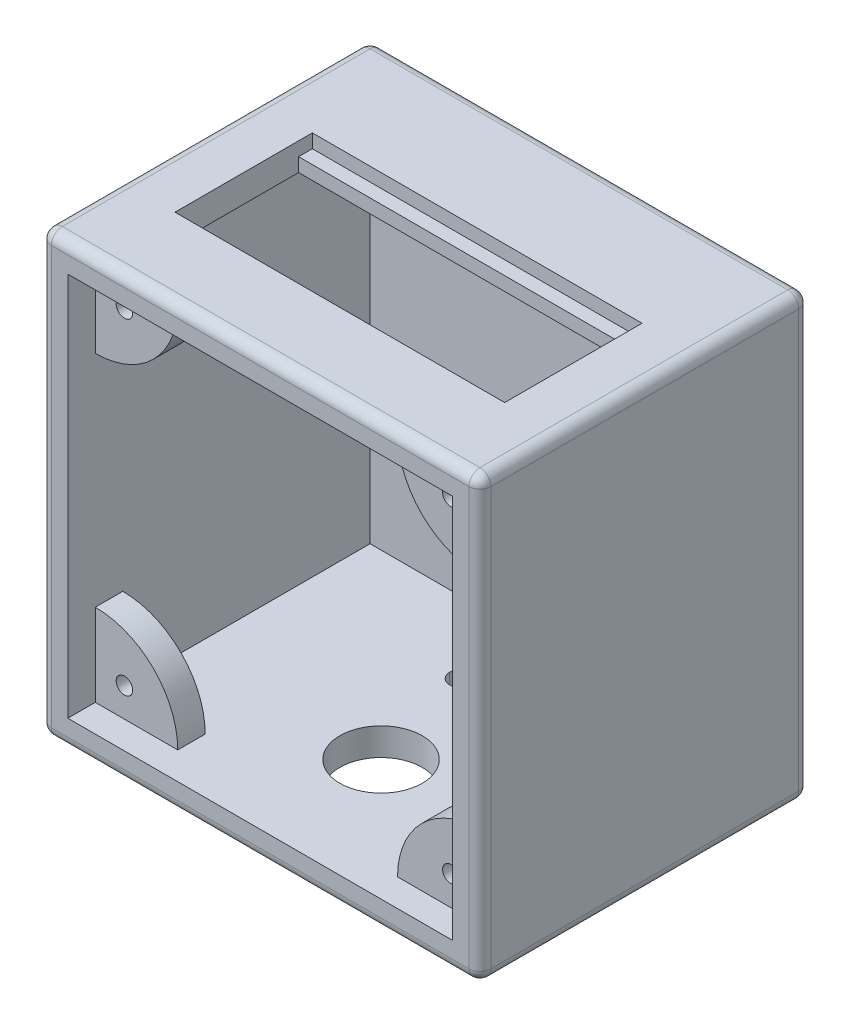
from build123d import *

# Parameters (mm, degrees)
SKETCH_1_W          = 80
SKETCH_1_H          = 80
EXTRUDE_2_DEPTH     = 60
SKETCH_2_W          = 70
SKETCH_2_H          = 70
CUT_EXTRUDE_1_DEPTH = 55
EXTRUDE_3_DEPTH     = 10
EXTRUDE_3_2_DEPTH   = 10
EXTRUDE_3_3_DEPTH   = 10
EXTRUDE_3_4_DEPTH   = 10
CUT_EXTRUDE_2_DEPTH = 5
SKETCH_6_R          = 1.5
CUT_EXTRUDE_3_DEPTH = 5
CUT_EXTRUDE_4_DEPTH = 5
FILLET_1_R          = 2
FILLET_2_R          = 2
FILLET_3_R          = 2
FILLET_4_R          = 2
SKETCH_10_R         = 7.5
CUT_EXTRUDE_5_DEPTH = 5
SKETCH_11_W         = 60
SKETCH_11_H         = 20
CUT_EXTRUDE_6_DEPTH = 5
SKETCH_12_W         = 60
SKETCH_12_H         = 2.5
CUT_EXTRUDE_9_DEPTH = 2.5


with BuildPart() as part:
    # Эскиз1 → Бобышка-Вытянуть2 (new body)
    with BuildSketch(Plane.XY):
        Rectangle(SKETCH_1_W, SKETCH_1_H)
    extrude(amount=EXTRUDE_2_DEPTH)

    # Эскиз2 → Вырез-Вытянуть1 (cut)
    with BuildSketch(Plane.XY.offset(60)):
        Rectangle(SKETCH_2_W, SKETCH_2_H)
    extrude(amount=-CUT_EXTRUDE_1_DEPTH, mode=Mode.SUBTRACT)

    # Эскиз7 → Вырез-Вытянуть4 (cut)
    with BuildSketch(Plane.XZ.offset(40)):
        with BuildLine():
            Line((5.5, 20), (-5.5, 20))
            ThreePointArc((-5.5, 20), (-6.914213562, 19.414213562), (-7.5, 18))
            Line((-7.5, 18), (-7.5, 12))
            ThreePointArc((-7.5, 12), (-6.914213562, 10.585786438), (-5.5, 10))
            Line((-5.5, 10), (5.5, 10))
            ThreePointArc((5.5, 10), (6.914213562, 10.585786438), (7.5, 12))
            Line((7.5, 12), (7.5, 18))
            ThreePointArc((7.5, 18), (6.914213562, 19.414213562), (5.5, 20))
        make_face()
    extrude(amount=-CUT_EXTRUDE_4_DEPTH, mode=Mode.SUBTRACT)

    # Скругление1
    fillet_1_edges = [part.edges().sort_by_distance(p)[0] for p in [
        (40, -40, 30),
        (-40, -40, 30),
    ]]
    fillet(fillet_1_edges, radius=FILLET_1_R)

    # Скругление2
    fillet_2_edges = [part.edges().sort_by_distance(p)[0] for p in [
        (-40, 40, 30),
        (40, 40, 30),
    ]]
    fillet(fillet_2_edges, radius=FILLET_2_R)

    # Скругление3
    fillet_3_edges = [part.edges().sort_by_distance(p)[0] for p in [
        (39.414213562, 39.414213562, 60),
        (39.414213562, -39.414213562, 60),
        (-39.414213562, -39.414213562, 60),
        (-39.414213562, 39.414213562, 60),
        (0, -40, 60),
        (-40, 0, 60),
        (40, 0, 60),
        (0, 40, 60),
    ]]
    fillet(fillet_3_edges, radius=FILLET_3_R)

    # Скругление4
    fillet_4_edges = [part.edges().sort_by_distance(p)[0] for p in [
        (-39.414213562, -39.414213562, 0),
        (-39.414213562, 39.414213562, 0),
        (39.414213562, 39.414213562, 0),
        (39.414213562, -39.414213562, 0),
        (-40, 0, 0),
        (0, 40, 0),
        (40, 0, 0),
        (0, -40, 0),
    ]]
    fillet(fillet_4_edges, radius=FILLET_4_R)

    # Эскиз10 → Вырез-Вытянуть5 (cut)
    with BuildSketch(Plane.XZ.offset(40)):
        with Locations((0, 38)):
            Circle(SKETCH_10_R)
    extrude(amount=-CUT_EXTRUDE_5_DEPTH, mode=Mode.SUBTRACT)

    # Эскиз11 → Вырез-Вытянуть6 (cut)
    with BuildSketch(Plane(origin=(0, 40, 0), x_dir=(1, 0, 0), z_dir=(0, 1, 0))):
        with Locations((0, -33)):
            Rectangle(SKETCH_11_W, SKETCH_11_H)
    extrude(amount=-CUT_EXTRUDE_6_DEPTH, mode=Mode.SUBTRACT)

    # Эскиз12 → Вырез-Вытянуть9 (cut)
    with BuildSketch(Plane(origin=(0, 40, 0), x_dir=(1, 0, 0), z_dir=(0, 1, 0))):
        with Locations((0, -21.75)):
            Rectangle(SKETCH_12_W, SKETCH_12_H)
        with Locations((0, -44.25)):
            Rectangle(SKETCH_12_W, SKETCH_12_H)
    extrude(amount=-CUT_EXTRUDE_9_DEPTH, mode=Mode.SUBTRACT)


with BuildPart() as body_2:
    # Эскиз3 → Бобышка-Вытянуть3 (new body)
    with BuildSketch(Plane.XY.offset(60)):
        with BuildLine():
            Line((-35, 35), (-35, 20))
            ThreePointArc((-35, 20), (-24.393398282, 24.393398282), (-20, 35))
            Line((-20, 35), (-35, 35))
        make_face()
    extrude(amount=-EXTRUDE_3_DEPTH)


with BuildPart() as body_3:
    # Эскиз3 → Extrude 3 2 (new body)
    with BuildSketch(Plane.XY.offset(60)):
        with BuildLine():
            Line((35, 35), (35, 20))
            ThreePointArc((35, 20), (24.393398282, 24.393398282), (20, 35))
            Line((20, 35), (35, 35))
        make_face()
    extrude(amount=-EXTRUDE_3_2_DEPTH)


with BuildPart() as body_4:
    # Эскиз3 → Extrude 3 3 (new body)
    with BuildSketch(Plane.XY.offset(60)):
        with BuildLine():
            Line((20, -35), (35, -35))
            Line((35, -35), (35, -20))
            ThreePointArc((35, -20), (24.393398282, -24.393398282), (20, -35))
        make_face()
    extrude(amount=-EXTRUDE_3_3_DEPTH)


with BuildPart() as body_5:
    # Эскиз3 → Extrude 3 4 (new body)
    with BuildSketch(Plane.XY.offset(60)):
        with BuildLine():
            Line((-35, -20), (-35, -35))
            Line((-35, -35), (-20, -35))
            ThreePointArc((-20, -35), (-24.393398282, -24.393398282), (-35, -20))
        make_face()
    extrude(amount=-EXTRUDE_3_4_DEPTH)


with BuildPart() as cut_extrude_2_tool:
    # Эскиз5 → Вырез-Вытянуть2 (new body)
    with BuildSketch(Plane.XY.offset(60)):
        with BuildLine():
            Line((-35, 35), (-20, 35))
            ThreePointArc((-20, 35), (-24.393398282, 24.393398282), (-35, 20))
            Line((-35, 20), (-35, 35))
        make_face()
        with BuildLine():
            Line((35, 35), (35, 20))
            ThreePointArc((35, 20), (24.393398282, 24.393398282), (20, 35))
            Line((20, 35), (35, 35))
        make_face()
        with BuildLine():
            Line((35, -20), (35, -35))
            Line((35, -35), (20, -35))
            ThreePointArc((20, -35), (24.393398282, -24.393398282), (35, -20))
        make_face()
        with BuildLine():
            Line((-20, -35), (-35, -35))
            Line((-35, -35), (-35, -20))
            ThreePointArc((-35, -20), (-24.393398282, -24.393398282), (-20, -35))
        make_face()
    extrude(amount=-CUT_EXTRUDE_2_DEPTH)


with BuildPart() as body_2_1:
    add(body_2.part)

    # Вырез-Вытянуть2: cut by cut_extrude_2_tool
    add(cut_extrude_2_tool.part, mode=Mode.SUBTRACT)


with BuildPart() as body_3_1:
    add(body_3.part)

    # Вырез-Вытянуть2: cut by cut_extrude_2_tool
    add(cut_extrude_2_tool.part, mode=Mode.SUBTRACT)


with BuildPart() as body_4_1:
    add(body_4.part)

    # Вырез-Вытянуть2: cut by cut_extrude_2_tool
    add(cut_extrude_2_tool.part, mode=Mode.SUBTRACT)


with BuildPart() as body_5_1:
    add(body_5.part)

    # Вырез-Вытянуть2: cut by cut_extrude_2_tool
    add(cut_extrude_2_tool.part, mode=Mode.SUBTRACT)


with BuildPart() as cut_extrude_3_tool:
    # Эскиз6 → Вырез-Вытянуть3 (new body)
    with BuildSketch(Plane.XY.offset(55)):
        with Locations((-29.696699141, 29.696699141)):
            Circle(SKETCH_6_R)
        with Locations((29.696699141, 29.696699141)):
            Circle(SKETCH_6_R)
        with Locations((29.696699141, -29.696699141)):
            Circle(SKETCH_6_R)
        with Locations((-29.696699141, -29.696699141)):
            Circle(SKETCH_6_R)
    extrude(amount=-CUT_EXTRUDE_3_DEPTH)


with BuildPart() as body_2_2:
    add(body_2_1.part)

    # Вырез-Вытянуть3: cut by cut_extrude_3_tool
    add(cut_extrude_3_tool.part, mode=Mode.SUBTRACT)


with BuildPart() as body_3_2:
    add(body_3_1.part)

    # Вырез-Вытянуть3: cut by cut_extrude_3_tool
    add(cut_extrude_3_tool.part, mode=Mode.SUBTRACT)


with BuildPart() as body_4_2:
    add(body_4_1.part)

    # Вырез-Вытянуть3: cut by cut_extrude_3_tool
    add(cut_extrude_3_tool.part, mode=Mode.SUBTRACT)


with BuildPart() as body_5_2:
    add(body_5_1.part)

    # Вырез-Вытянуть3: cut by cut_extrude_3_tool
    add(cut_extrude_3_tool.part, mode=Mode.SUBTRACT)


solid = Compound([part.part, body_2_2.part, body_3_2.part, body_4_2.part, body_5_2.part])
